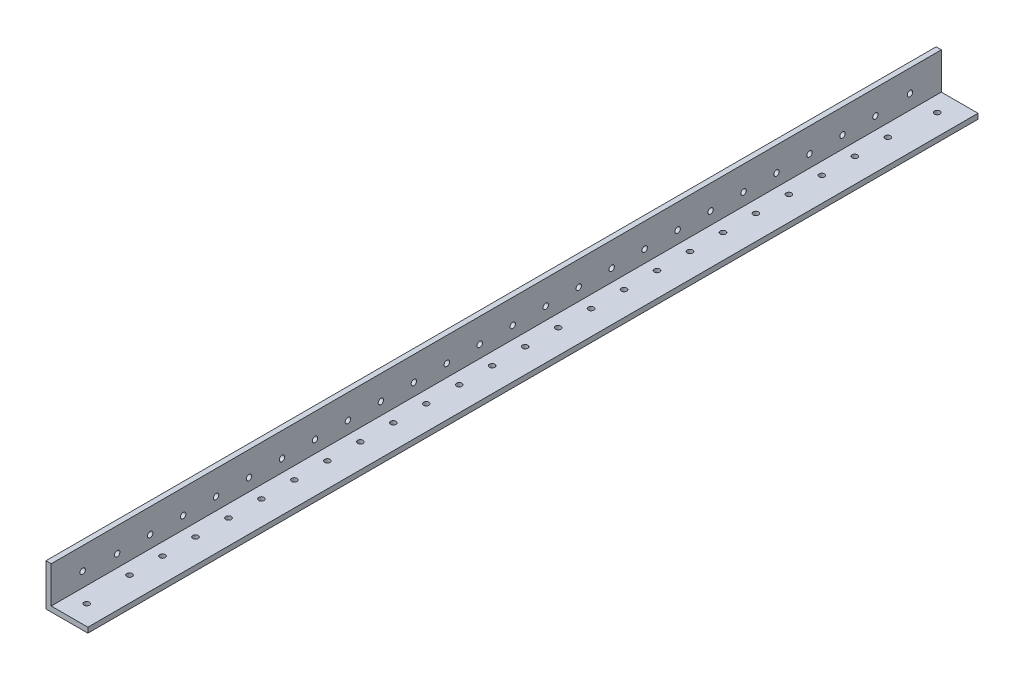
from build123d import *

# Parameters (mm, degrees)
BOSS_EXTRUDE1_DEPTH = 1219.2
FILLET1_R           = 0.4064
SKETCH4_W           = 1898.4
SKETCH4_H           = 103.278519729
CUT_EXTRUDE1_DEPTH  = 60
SKETCH5_W           = 2.47699065
SKETCH5_H           = 2.94685794
CUT_EXTRUDE2_DEPTH  = 600
SKETCH8_R           = 1.65
CUT_EXTRUDE4_DEPTH  = 20
SKETCH9_R           = 1.65
CUT_EXTRUDE5_DEPTH  = 20
SKETCH10_R          = 1.65
CUT_EXTRUDE6_DEPTH  = 70
SKETCH11_R          = 1.65
CUT_EXTRUDE7_DEPTH  = 70


with BuildPart() as part:
    # Sketch3 → Boss-Extrude1 (new, symmetric)
    with BuildSketch(Plane.XY):
        Polygon((3.175, 25.4), (0, 25.4), (0, 0), (25.4, 0), (25.4, 3.175), (3.175, 3.175), align=None)
    extrude(amount=BOSS_EXTRUDE1_DEPTH, both=True)

    # Fillet1
    fillet1_edges = [part.edges().sort_by_distance(p)[0] for p in [
        (3.175, 3.175, 0),
    ]]
    fillet(fillet1_edges, radius=FILLET1_R)

    # Sketch4 → Cut-Extrude1 (cut)
    with BuildSketch(Plane.ZY):
        with Locations((-270, -26.239259864)):
            Rectangle(SKETCH4_W, SKETCH4_H)
    extrude(amount=-CUT_EXTRUDE1_DEPTH, mode=Mode.SUBTRACT)

    # Sketch5 → Cut-Extrude2 (cut)
    with BuildSketch(Plane(origin=(0, 0, 679.2), x_dir=(-1, 0, 0), z_dir=(0, 0, -1))):
        with Locations((-4.413495325, 4.64842897)):
            Rectangle(SKETCH5_W, SKETCH5_H)
    extrude(amount=-CUT_EXTRUDE2_DEPTH, mode=Mode.SUBTRACT)

    # Sketch8 → Cut-Extrude4 (cut)
    with BuildSketch(Plane(origin=(3.175, 0, 0), x_dir=(0, 0, -1), z_dir=(1, 0, 0))):
        with Locations((-1179.2, 10.675)):
            Circle(SKETCH8_R)
        with Locations((-1159.2, 10.675)):
            Circle(SKETCH8_R)
        with Locations((-1139.2, 10.675)):
            Circle(SKETCH8_R)
        with Locations((-1119.2, 10.675)):
            Circle(SKETCH8_R)
        with Locations((-1099.2, 10.675)):
            Circle(SKETCH8_R)
        with Locations((-1079.2, 10.675)):
            Circle(SKETCH8_R)
        with Locations((-1059.2, 10.675)):
            Circle(SKETCH8_R)
        with Locations((-1039.2, 10.675)):
            Circle(SKETCH8_R)
        with Locations((-1019.2, 10.675)):
            Circle(SKETCH8_R)
        with Locations((-999.2, 10.675)):
            Circle(SKETCH8_R)
        with Locations((-979.2, 10.675)):
            Circle(SKETCH8_R)
        with Locations((-959.2, 10.675)):
            Circle(SKETCH8_R)
        with Locations((-939.2, 10.675)):
            Circle(SKETCH8_R)
        with Locations((-919.2, 10.675)):
            Circle(SKETCH8_R)
        with Locations((-899.2, 10.675)):
            Circle(SKETCH8_R)
        with Locations((-879.2, 10.675)):
            Circle(SKETCH8_R)
        with Locations((-859.2, 10.675)):
            Circle(SKETCH8_R)
        with Locations((-839.2, 10.675)):
            Circle(SKETCH8_R)
        with Locations((-819.2, 10.675)):
            Circle(SKETCH8_R)
        with Locations((-799.2, 10.675)):
            Circle(SKETCH8_R)
        with Locations((-779.2, 10.675)):
            Circle(SKETCH8_R)
        with Locations((-759.2, 10.675)):
            Circle(SKETCH8_R)
        with Locations((-739.2, 10.675)):
            Circle(SKETCH8_R)
        with Locations((-719.2, 10.675)):
            Circle(SKETCH8_R)
    extrude(amount=-CUT_EXTRUDE4_DEPTH, mode=Mode.SUBTRACT)

    # Sketch9 → Cut-Extrude5 (cut)
    with BuildSketch(Plane(origin=(0, 3.175, 0), x_dir=(1, 0, 0), z_dir=(0, 1, 0))):
        with Locations((10.675, -1179.2)):
            Circle(SKETCH9_R)
        with Locations((10.675, -1159.2)):
            Circle(SKETCH9_R)
        with Locations((10.675, -1139.2)):
            Circle(SKETCH9_R)
        with Locations((10.675, -1119.2)):
            Circle(SKETCH9_R)
        with Locations((10.675, -1099.2)):
            Circle(SKETCH9_R)
        with Locations((10.675, -1079.2)):
            Circle(SKETCH9_R)
        with Locations((10.675, -1059.2)):
            Circle(SKETCH9_R)
        with Locations((10.675, -1039.2)):
            Circle(SKETCH9_R)
        with Locations((10.675, -1019.2)):
            Circle(SKETCH9_R)
        with Locations((10.675, -999.2)):
            Circle(SKETCH9_R)
        with Locations((10.675, -979.2)):
            Circle(SKETCH9_R)
        with Locations((10.675, -959.2)):
            Circle(SKETCH9_R)
        with Locations((10.675, -939.2)):
            Circle(SKETCH9_R)
        with Locations((10.675, -919.2)):
            Circle(SKETCH9_R)
        with Locations((10.675, -899.2)):
            Circle(SKETCH9_R)
        with Locations((10.675, -879.2)):
            Circle(SKETCH9_R)
        with Locations((10.675, -859.2)):
            Circle(SKETCH9_R)
        with Locations((10.675, -839.2)):
            Circle(SKETCH9_R)
        with Locations((10.675, -819.2)):
            Circle(SKETCH9_R)
        with Locations((10.675, -799.2)):
            Circle(SKETCH9_R)
        with Locations((10.675, -779.2)):
            Circle(SKETCH9_R)
        with Locations((10.675, -759.2)):
            Circle(SKETCH9_R)
        with Locations((10.675, -739.2)):
            Circle(SKETCH9_R)
        with Locations((10.675, -719.2)):
            Circle(SKETCH9_R)
    extrude(amount=-CUT_EXTRUDE5_DEPTH, mode=Mode.SUBTRACT)

    # Sketch10 → Cut-Extrude6 (cut)
    with BuildSketch(Plane(origin=(3.175, 0, 0), x_dir=(0, 0, -1), z_dir=(1, 0, 0))):
        with Locations((-1200.15, 11.9634)):
            Circle(SKETCH10_R)
        with Locations((-698.25, 11.9634)):
            Circle(SKETCH10_R)
    extrude(amount=-CUT_EXTRUDE6_DEPTH, mode=Mode.SUBTRACT)

    # Sketch11 → Cut-Extrude7 (cut)
    with BuildSketch(Plane(origin=(0, 3.175, 0), x_dir=(1, 0, 0), z_dir=(0, 1, 0))):
        with Locations((12.7, -691.195704333)):
            Circle(SKETCH11_R)
        with Locations((12.7, -1207.204295667)):
            Circle(SKETCH11_R)
    extrude(amount=-CUT_EXTRUDE7_DEPTH, mode=Mode.SUBTRACT)


solid = part.part
